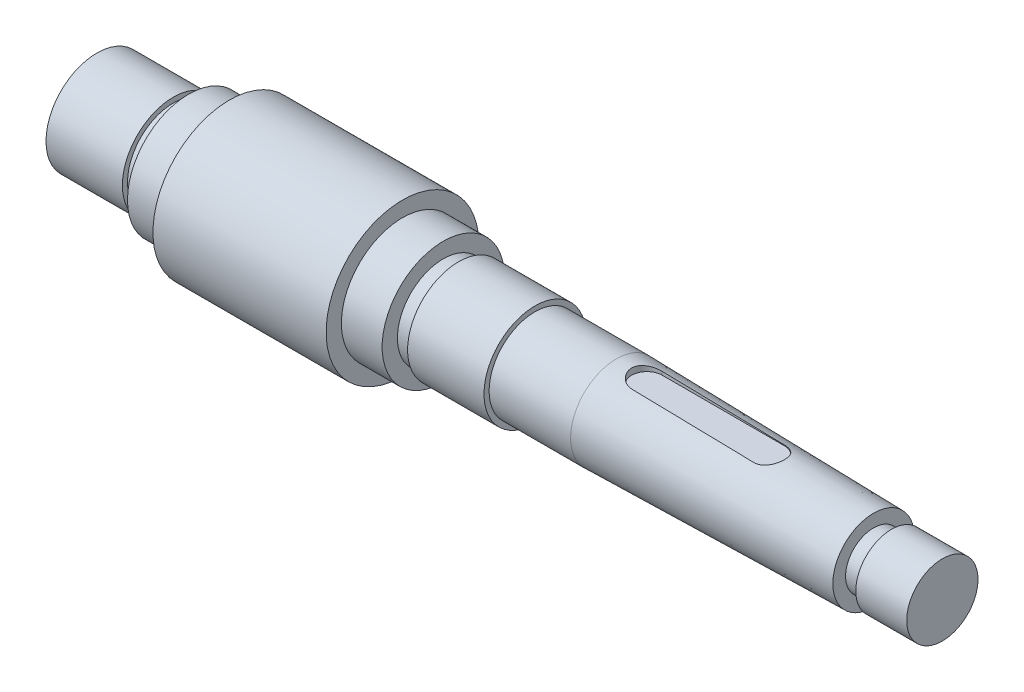
from build123d import *

# Parameters (mm, degrees)
SKETCH_1_R          = 15
EXTRUDE_1_DEPTH     = 34
SKETCH_2_R          = 12
EXTRUDE_2_DEPTH     = 8
SKETCH_3_R          = 9
EXTRUDE_3_DEPTH     = 3
SKETCH_4_R          = 10
EXTRUDE_4_DEPTH     = 15
SKETCH_5_R          = 9
EXTRUDE_5_DEPTH     = 16
EXTRUDE_START       = 8
SKETCH_6_R          = 12
EXTRUDE_6_DEPTH     = 8
EXTRUDE_START_2     = 3
SKETCH_7_R          = 9
EXTRUDE_7_DEPTH     = 3
EXTRUDE_START_3     = 15
SKETCH_8_R          = 10
EXTRUDE_8_DEPTH     = 15
SKETCH_9_R          = 7
EXTRUDE_9_DEPTH     = 10
SKETCH_10_R         = 5.5
EXTRUDE_10_DEPTH    = 3.5
CUT_EXTRUDE_START   = 7.7
CUT_EXTRUDE_1_DEPTH = 3.5


# Read off the part's stored shape, not the designer's step: 放样1
with BuildPart() as part:
    # 草图1 → 凸台-拉伸1 (new body)
    with BuildSketch(Plane(origin=(0, 0, 0), x_dir=(0, 0, -1), z_dir=(1, 0, 0))):
        Circle(SKETCH_1_R)
    extrude(amount=EXTRUDE_1_DEPTH)

    # 草图2 → 凸台-拉伸2 (add)
    with BuildSketch(Plane(origin=(34, 0, 0), x_dir=(0, 0, -1), z_dir=(1, 0, 0))):
        Circle(SKETCH_2_R)
    extrude(amount=EXTRUDE_2_DEPTH)

    # 草图3 → 凸台-拉伸3 (add)
    with BuildSketch(Plane(origin=(42, 0, 0), x_dir=(0, 0, -1), z_dir=(1, 0, 0))):
        Circle(SKETCH_3_R)
    extrude(amount=EXTRUDE_3_DEPTH)

    # 草图4 → 凸台-拉伸4 (add)
    with BuildSketch(Plane(origin=(45, 0, 0), x_dir=(0, 0, -1), z_dir=(1, 0, 0))):
        Circle(SKETCH_4_R)
    extrude(amount=EXTRUDE_4_DEPTH)

    # 草图5 → 凸台-拉伸5 (add)
    with BuildSketch(Plane(origin=(60, 0, 0), x_dir=(0, 0, -1), z_dir=(1, 0, 0))):
        Circle(SKETCH_5_R)
    extrude(amount=EXTRUDE_5_DEPTH)

    # 草图6 → 凸台-拉伸6 (add)
    with BuildSketch(Plane.ZY.offset(EXTRUDE_START)):
        with Locations(Location((0, 0, 0), (0, 0, 180))):
            Circle(SKETCH_6_R)
    extrude(amount=-EXTRUDE_6_DEPTH)

    # 草图7 → 凸台-拉伸7 (add)
    with BuildSketch(Plane.ZY.offset(8).offset(EXTRUDE_START_2)):
        with Locations(Location((0, 0, 0), (0, 0, 180))):
            Circle(SKETCH_7_R)
    extrude(amount=-EXTRUDE_7_DEPTH)

    # 草图8 → 凸台-拉伸8 (add)
    with BuildSketch(Plane.ZY.offset(11).offset(EXTRUDE_START_3)):
        with Locations(Location((0, 0, 0), (0, 0, 180))):
            Circle(SKETCH_8_R)
    extrude(amount=-EXTRUDE_8_DEPTH)



with BuildPart() as body_2:
    # 草图9 → 凸台-拉伸9 (new body)
    with BuildSketch(Plane(origin=(130, 0, 0), x_dir=(0, 0, -1), z_dir=(1, 0, 0))):
        Circle(SKETCH_9_R)
    extrude(amount=EXTRUDE_9_DEPTH)

    # 草图10 → 凸台-拉伸10 (add)
    with BuildSketch(Plane.ZY.offset(-130)):
        with Locations(Location((0, 0, 0), (0, 0, 180))):
            Circle(SKETCH_10_R)
    extrude(amount=EXTRUDE_10_DEPTH)


with BuildPart() as part_1:
    add(part.part)

    add(body_2.part)  # 放样1 merges body 2
    # 放样1 outline → 放样1 (revolve)
    with BuildSketch(Plane.YX):
        Polygon((8, 126.5), (0, 126.5), (0, 76), (9, 76), align=None)
    revolve(axis=Axis((0, 0, 0), (1, 0, 0)))

    # 草图12 → 切除-拉伸1 (cut)
    with BuildSketch(Plane(origin=(0, 0, 0), x_dir=(1, 0, 0), z_dir=(0, 1, 0)).offset(CUT_EXTRUDE_START)):
        with BuildLine():
            Line((82, -3), (106, -3))
            ThreePointArc((106, -3), (109, 0), (106, 3))
            Line((106, 3), (82, 3))
            ThreePointArc((82, 3), (79, 0), (82, -3))
        make_face()
    extrude(amount=CUT_EXTRUDE_1_DEPTH, mode=Mode.SUBTRACT)


solid = part_1.part
